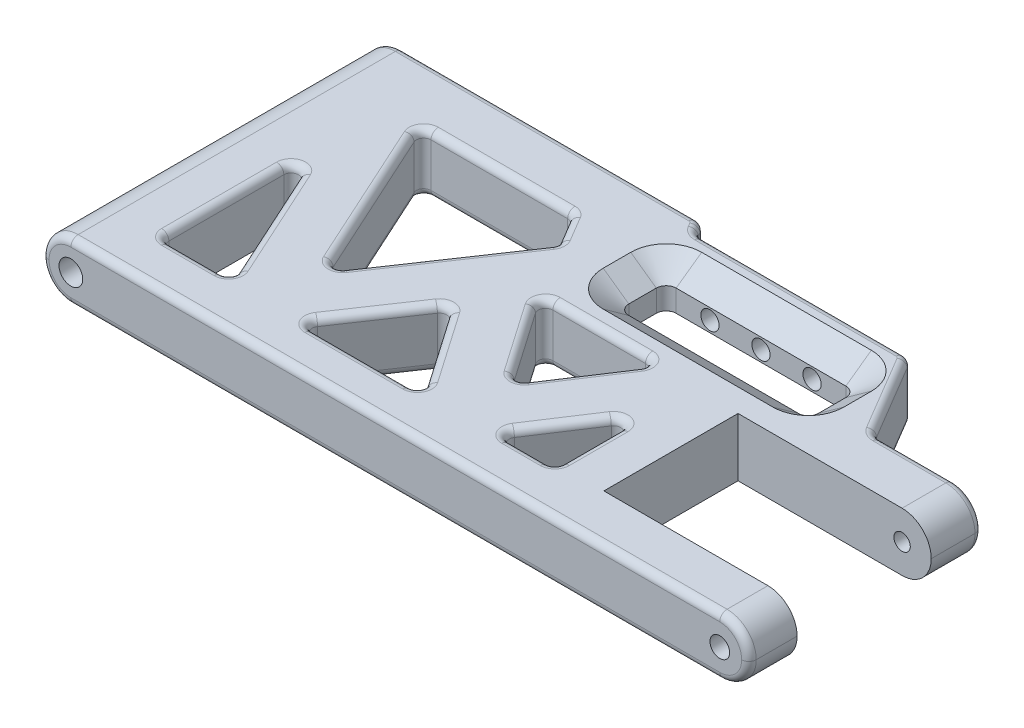
from build123d import *
from OCP.BRepFilletAPI import BRepFilletAPI_MakeChamfer

# Parameters (mm, degrees)
BOSS_EXTRU_1_DEPTH                            = 4
BOSS_EXTRU_1_DEPTH_BACK                       = 4
CONG_1_R                                      = 4
CONG_2_R                                      = 1
CHANFREIN2_SIZE                               = 3.5
CHANFREIN2_SIZE2                              = 2.5
CHANFREIN3_SIZE                               = 2.5
CHANFREIN3_SIZE2                              = 3.5
ENL_V_MAT_EXTRU_1_DEPTH                       = 100.712398932
ENL_V_MAT_EXTRU_1_DEPTH_BACK                  = 8.25
ESQUISSE6_R                                   = 1.125
ENL_V_MAT_EXTRU_2_DEPTH                       = 100.712398932
ENL_V_MAT_EXTRU_2_DEPTH_BACK                  = 100.712398932
ESQUISSE14_R                                  = 1.625
TROU_TARAUD_M31_D                             = 2.5
TROU_TARAUD_M31_DEPTH                         = 16
TROU_TARAUD_M31_TIP                           = 0.751075774
TROU_POUR_TARAUDAGE_POUR_TROU_TARAUD_M3_D     = 2.7
TROU_POUR_TARAUDAGE_POUR_TROU_TARAUD_M3_DEPTH = 3
TROU_POUR_TARAUDAGE_POUR_TROU_TARAUD_M3_TIP   = 0.811161836


with BuildPart() as part:
    # Esquisse1 → Boss.-Extru.1 (new, two sides: drawn at the far end of the back side and taken through both)
    with BuildSketch(Plane(origin=(0, 0, 0), x_dir=(1, 0, 0), z_dir=(0, 1, 0)).offset(-BOSS_EXTRU_1_DEPTH_BACK)):
        with BuildLine():
            Line((97, 2.25), (97, 9.25))
            Line((97, 9.25), (83, 9.25))
            ThreePointArc((83, 9.25), (82.325488354, 9.428591801), (81.827729995, 9.917567882))
            Line((81.827729995, 9.917567882), (75.708100575, 20.232432118))
            ThreePointArc((75.708100575, 20.232432118), (75.210342216, 20.721408199), (74.53583057, 20.9))
            Line((74.53583057, 20.9), (46.908568545, 20.9))
            ThreePointArc((46.908568545, 20.9), (46.234056899, 21.078591801), (45.73629854, 21.567567882))
            Line((45.73629854, 21.567567882), (45.43083855, 22.082432118))
            ThreePointArc((45.43083855, 22.082432118), (44.933080191, 22.571408199), (44.258568545, 22.75))
            Line((44.258568545, 22.75), (0, 22.75))
            Line((0, 22.75), (0, -22.75))
            Line((0, -22.75), (97, -22.75))
            Line((97, -22.75), (97, -16.15))
            Line((97, -16.15), (70.5, -16.15))
            Line((70.5, -16.15), (70.5, 2.25))
            Line((70.5, 2.25), (97, 2.25))
        make_face()
        with BuildLine():
            Line((64.118926942, -15.494213934), (64.118926942, -7.467196467))
            ThreePointArc((64.118926942, -7.467196467), (63.40501164, -6.508992133), (62.28261585, -6.918941272))
            Line((62.28261585, -6.918941272), (57.020394564, -14.945958739))
            ThreePointArc((57.020394564, -14.945958739), (56.976860443, -15.969474287), (57.856705655, -16.494213934))
            Line((57.856705655, -16.494213934), (63.118926942, -16.494213934))
            ThreePointArc((63.118926942, -16.494213934), (63.826033723, -16.201320715), (64.118926942, -15.494213934))
        make_face(mode=Mode.SUBTRACT)
        with BuildLine():
            Line((43.706678059, 1.262360149), (50.246967928, -8.178055844))
            ThreePointArc((50.246967928, -8.178055844), (51.081770931, -8.608492208), (51.905283012, -8.156829314))
            Line((51.905283012, -8.156829314), (58.077143514, 1.257756154))
            ThreePointArc((58.077143514, 1.257756154), (58.121403942, 2.298347662), (57.226879713, 2.831841874))
            Line((57.226879713, 2.831841874), (44.528682052, 2.831841874))
            ThreePointArc((44.528682052, 2.831841874), (43.642826046, 2.29580215), (43.706678059, 1.262360149))
        make_face(mode=Mode.SUBTRACT)
        with BuildLine():
            Line((31.174870916, -16.835427898), (44.603118761, -16.835427898))
            ThreePointArc((44.603118761, -16.835427898), (45.488974767, -16.299388174), (45.425122754, -15.265946173))
            Line((45.425122754, -15.265946173), (38.625355248, -5.450993747))
            ThreePointArc((38.625355248, -5.450993747), (37.797407047, -5.02049314), (36.974635235, -5.460806143))
            Line((36.974635235, -5.460806143), (30.346154896, -15.275758569))
            ThreePointArc((30.346154896, -15.275758569), (30.291788437, -16.304645689), (31.174870916, -16.835427898))
        make_face(mode=Mode.SUBTRACT)
        with BuildLine():
            Line((11, -16.307365767), (18.197304045, -16.307365767))
            ThreePointArc((18.197304045, -16.307365767), (19.038505434, -15.848087712), (19.107016148, -14.89212621))
            Line((19.107016148, -14.89212621), (11.909712103, 0.875819046))
            ThreePointArc((11.909712103, 0.875819046), (10.787528947, 1.437746851), (10, 0.460579489))
            Line((10, 0.460579489), (10, -15.307365767))
            ThreePointArc((10, -15.307365767), (10.292893219, -16.014472548), (11, -16.307365767))
        make_face(mode=Mode.SUBTRACT)
        with BuildLine():
            Line((15.042983852, 13.277394676), (24.357941957, -7.129934034))
            ThreePointArc((24.357941957, -7.129934034), (25.184858643, -7.711261043), (26.09637008, -7.274363807))
            Line((26.09637008, -7.274363807), (37.559429709, 9.69926803))
            ThreePointArc((37.559429709, 9.69926803), (37.73028563, 10.229680965), (37.590744848, 10.769178877))
            Line((37.590744848, 10.769178877), (35.553592257, 14.20287575))
            ThreePointArc((35.553592257, 14.20287575), (35.188413846, 14.561611079), (34.693561099, 14.692634233))
            Line((34.693561099, 14.692634233), (15.952695955, 14.692634233))
            ThreePointArc((15.952695955, 14.692634233), (15.111494566, 14.233356178), (15.042983852, 13.277394676))
        make_face(mode=Mode.SUBTRACT)
        with BuildLine():
            Line((48.863055272, 15.4), (72.136944728, 15.4))
            ThreePointArc((72.136944728, 15.4), (73.100770354, 15.000770354), (73.5, 14.036944728))
            Line((73.5, 14.036944728), (73.5, 10.263055272))
            ThreePointArc((73.5, 10.263055272), (73.100770354, 9.299229646), (72.136944728, 8.9))
            Line((72.136944728, 8.9), (48.863055272, 8.9))
            ThreePointArc((48.863055272, 8.9), (47.899229646, 9.299229646), (47.5, 10.263055272))
            Line((47.5, 10.263055272), (47.5, 14.036944728))
            ThreePointArc((47.5, 14.036944728), (47.899229646, 15.000770354), (48.863055272, 15.4))
        make_face(mode=Mode.SUBTRACT)
    extrude(amount=BOSS_EXTRU_1_DEPTH + BOSS_EXTRU_1_DEPTH_BACK)

    # Congé1
    cong_1_edges = [part.edges().sort_by_distance(p)[0] for p in [
        (0, 4, 0),
        (97, -4, -5.75),
        (97, -4, 19.45),
        (97, 4, 19.45),
        (97, 4, -5.75),
        (0, -4, 0),
    ]]
    fillet(cong_1_edges, radius=CONG_1_R - 0.0001)  # a hair under: the kernel refuses the full size

    # Congé2
    cong_2_edges = [part.edges().sort_by_distance(p)[0] for p in [
        (25.184858643, -4, 7.711261043),
        (19.700462905, -4, -3.073730321),
        (15.111494566, -4, -14.233356178),
        (25.323128527, -4, -14.692634233),
        (35.188413846, -4, -14.561611079),
        (36.572168553, -4, -12.486027314),
        (37.73028563, -4, -10.229680965),
        (31.827899895, -4, -1.212452112),
        (82.325488354, 4, -9.428591801),
        (78.767915285, 4, -15.075),
        (75.210342216, 4, -20.721408199),
        (60.722199558, 4, -20.9),
        (46.234056899, 4, -21.078591801),
        (45.583568545, 4, -21.825),
        (44.933080191, 4, -22.571408199),
        (24.129234273, 4, -22.75),
        (63.826033723, 4, 16.201320715),
        (64.118926942, 4, 11.480705201),
        (63.40501164, 4, 6.508992133),
        (59.651505207, 4, 10.932450006),
        (56.976860443, 4, 15.969474287),
        (60.487816298, 4, 16.494213934),
        (43.642826046, 4, -2.29580215),
        (46.976822993, 4, 3.457847847),
        (51.081770931, 4, 8.608492208),
        (54.991213263, 4, 3.44953658),
        (58.121403942, 4, -2.298347662),
        (50.877780882, 4, -2.831841874),
        (45.488974767, 4, 16.299388174),
        (42.025239001, 4, 10.35846996),
        (37.797407047, 4, 5.02049314),
        (33.660395066, 4, 10.368282356),
        (30.291788437, 4, 16.304645689),
        (37.888994839, 4, 16.835427898),
        (19.038505434, 4, 15.848087712),
        (15.508364125, 4, 7.008153582),
        (10.787528947, 4, -1.437746851),
        (10, 4, 7.423393139),
        (10.292893219, 4, 16.014472548),
        (14.598652022, 4, 16.307365767),
        (25.184858643, 4, 7.711261043),
        (31.827899895, 4, -1.212452112),
        (37.73028563, 4, -10.229680965),
        (36.572168553, 4, -12.486027314),
        (35.188413846, 4, -14.561611079),
        (25.323128527, 4, -14.692634233),
        (15.111494566, 4, -14.233356178),
        (19.700462905, 4, -3.073730321),
        (82.325488354, -4, -9.428591801),
        (88.00005, 4, -9.25),
        (88.00005, -4, -9.25),
        (95.828456414, 2.828456414, -9.25),
        (95.828456414, -2.828456414, -9.25),
        (48.5, -4, 22.75),
        (48.5, 4, 22.75),
        (1.171543586, 2.828456414, 22.75),
        (1.171543586, -2.828456414, 22.75),
        (95.828456414, 2.828456414, 22.75),
        (95.828456414, -2.828456414, 22.75),
        (1.171543586, 2.828456414, -22.75),
        (1.171543586, -2.828456414, -22.75),
        (78.767915285, -4, -15.075),
        (75.210342216, -4, -20.721408199),
        (60.722199558, -4, -20.9),
        (46.234056899, -4, -21.078591801),
        (63.826033723, -4, 16.201320715),
        (45.583568545, -4, -21.825),
        (60.487816298, -4, 16.494213934),
        (56.976860443, -4, 15.969474287),
        (59.651505207, -4, 10.932450006),
        (63.40501164, -4, 6.508992133),
        (64.118926942, -4, 11.480705201),
        (44.933080191, -4, -22.571408199),
        (24.129234273, -4, -22.75),
        (43.642826046, -4, -2.29580215),
        (50.877780882, -4, -2.831841874),
        (58.121403942, -4, -2.298347662),
        (54.991213263, -4, 3.44953658),
        (51.081770931, -4, 8.608492208),
        (46.976822993, -4, 3.457847847),
        (45.488974767, -4, 16.299388174),
        (37.888994839, -4, 16.835427898),
        (30.291788437, -4, 16.304645689),
        (33.660395066, -4, 10.368282356),
        (37.797407047, -4, 5.02049314),
        (42.025239001, -4, 10.35846996),
    ]]
    fillet(cong_2_edges, radius=CONG_2_R)

    # Chanfrein2
    chanfrein2_edges = [part.edges().sort_by_distance(p)[0] for p in [
        (47.899229646, 4, -15.000770354),
        (47.5, 4, -12.15),
        (47.899229646, 4, -9.299229646),
        (60.5, 4, -8.9),
        (73.100770354, 4, -9.299229646),
        (73.5, 4, -12.15),
        (73.100770354, 4, -15.000770354),
        (60.5, 4, -15.4),
    ]]
    chanfrein2_side = [part.faces().sort_by_distance(p)[0] for p in [
        (43.729526478, 4, 0.683000993),
    ]]
    chamfer(chanfrein2_edges, length=CHANFREIN2_SIZE, length2=CHANFREIN2_SIZE2, reference=chanfrein2_side[0])

    # Chanfrein3: one chamfer whose edges measure the first distance from different faces: ONE call of the kernel's chamfer builder (chamfer() names one face for all edges)
    chanfrein3_edges_1 = [part.edges().sort_by_distance(p)[0] for p in [
        (47.899229646, -4, -15.000770354),
    ]]
    chanfrein3_side_1 = [part.faces().sort_by_distance(p)[0] for p in [
        (47.899229646, -1.25, -15.000770354),
    ]]
    chanfrein3_edges_2 = [part.edges().sort_by_distance(p)[0] for p in [
        (60.5, -4, -15.4),
    ]]
    chanfrein3_side_2 = [part.faces().sort_by_distance(p)[0] for p in [
        (60.5, -1.25, -15.4),
    ]]
    chanfrein3_edges_3 = [part.edges().sort_by_distance(p)[0] for p in [
        (73.100770354, -4, -15.000770354),
    ]]
    chanfrein3_side_3 = [part.faces().sort_by_distance(p)[0] for p in [
        (73.100770354, -1.25, -15.000770354),
    ]]
    chanfrein3_edges_4 = [part.edges().sort_by_distance(p)[0] for p in [
        (73.5, -4, -12.15),
    ]]
    chanfrein3_side_4 = [part.faces().sort_by_distance(p)[0] for p in [
        (73.5, -1.25, -12.15),
    ]]
    chanfrein3_edges_5 = [part.edges().sort_by_distance(p)[0] for p in [
        (73.100770354, -4, -9.299229646),
    ]]
    chanfrein3_side_5 = [part.faces().sort_by_distance(p)[0] for p in [
        (73.100770354, -1.25, -9.299229646),
    ]]
    chanfrein3_edges_6 = [part.edges().sort_by_distance(p)[0] for p in [
        (60.5, -4, -8.9),
    ]]
    chanfrein3_side_6 = [part.faces().sort_by_distance(p)[0] for p in [
        (60.5, -1.25, -8.9),
    ]]
    chanfrein3_edges_7 = [part.edges().sort_by_distance(p)[0] for p in [
        (47.899229646, -4, -9.299229646),
    ]]
    chanfrein3_side_7 = [part.faces().sort_by_distance(p)[0] for p in [
        (47.899229646, -1.25, -9.299229646),
    ]]
    chanfrein3_edges_8 = [part.edges().sort_by_distance(p)[0] for p in [
        (47.5, -4, -12.15),
    ]]
    chanfrein3_side_8 = [part.faces().sort_by_distance(p)[0] for p in [
        (47.5, -1.25, -12.15),
    ]]
    chanfrein3 = BRepFilletAPI_MakeChamfer(part.part.solid().wrapped)
    for e in chanfrein3_edges_1:
        chanfrein3.Add(CHANFREIN3_SIZE, CHANFREIN3_SIZE2, e.wrapped, chanfrein3_side_1[0].wrapped)  # the first distance lies on this face
    for e in chanfrein3_edges_2:
        chanfrein3.Add(CHANFREIN3_SIZE, CHANFREIN3_SIZE2, e.wrapped, chanfrein3_side_2[0].wrapped)  # the first distance lies on this face
    for e in chanfrein3_edges_3:
        chanfrein3.Add(CHANFREIN3_SIZE, CHANFREIN3_SIZE2, e.wrapped, chanfrein3_side_3[0].wrapped)  # the first distance lies on this face
    for e in chanfrein3_edges_4:
        chanfrein3.Add(CHANFREIN3_SIZE, CHANFREIN3_SIZE2, e.wrapped, chanfrein3_side_4[0].wrapped)  # the first distance lies on this face
    for e in chanfrein3_edges_5:
        chanfrein3.Add(CHANFREIN3_SIZE, CHANFREIN3_SIZE2, e.wrapped, chanfrein3_side_5[0].wrapped)  # the first distance lies on this face
    for e in chanfrein3_edges_6:
        chanfrein3.Add(CHANFREIN3_SIZE, CHANFREIN3_SIZE2, e.wrapped, chanfrein3_side_6[0].wrapped)  # the first distance lies on this face
    for e in chanfrein3_edges_7:
        chanfrein3.Add(CHANFREIN3_SIZE, CHANFREIN3_SIZE2, e.wrapped, chanfrein3_side_7[0].wrapped)  # the first distance lies on this face
    for e in chanfrein3_edges_8:
        chanfrein3.Add(CHANFREIN3_SIZE, CHANFREIN3_SIZE2, e.wrapped, chanfrein3_side_8[0].wrapped)  # the first distance lies on this face
    add(Compound.cast(chanfrein3.Shape()), mode=Mode.REPLACE)

    # Esquisse6 → Enlèv. mat.-Extru.1 (cut, two sides: drawn at the far end of the back side and taken through both)
    with BuildSketch(Plane.XY.offset(-ENL_V_MAT_EXTRU_1_DEPTH_BACK)):
        with Locations((93, 0)):
            Circle(ESQUISSE6_R)
    extrude(amount=ENL_V_MAT_EXTRU_1_DEPTH + ENL_V_MAT_EXTRU_1_DEPTH_BACK, mode=Mode.SUBTRACT)

    # Esquisse14 → Enlèv. mat.-Extru.2 (cut, two sides: drawn at the far end of the back side and taken through both)
    with BuildSketch(Plane.XY.offset(-ENL_V_MAT_EXTRU_2_DEPTH_BACK)):
        with Locations((4, 0)):
            Circle(ESQUISSE14_R)
    extrude(amount=ENL_V_MAT_EXTRU_2_DEPTH + ENL_V_MAT_EXTRU_2_DEPTH_BACK, mode=Mode.SUBTRACT)

    # Trou taraudé M31
    with Locations(Plane(origin=(0, 0, -20.9), x_dir=(-1, 0, 0), z_dir=(0, 0, -1))):
        with Locations((-60.5, 0), (-53.5, 0), (-67.5, 0)):
            Hole(TROU_TARAUD_M31_D / 2, depth=TROU_TARAUD_M31_DEPTH)
            with Locations((0, 0, -(TROU_TARAUD_M31_DEPTH + TROU_TARAUD_M31_TIP / 2))):  # 118° drill point
                Cone(0, TROU_TARAUD_M31_D / 2, TROU_TARAUD_M31_TIP, mode=Mode.SUBTRACT)

    # Trou pour taraudage pour trou taraudé M31
    with Locations(Plane.XY.offset(22.75)):
        with Locations((93, 0)):
            Hole(TROU_POUR_TARAUDAGE_POUR_TROU_TARAUD_M3_D / 2, depth=TROU_POUR_TARAUDAGE_POUR_TROU_TARAUD_M3_DEPTH)
            with Locations((0, 0, -(TROU_POUR_TARAUDAGE_POUR_TROU_TARAUD_M3_DEPTH + TROU_POUR_TARAUDAGE_POUR_TROU_TARAUD_M3_TIP / 2))):  # 118° drill point
                Cone(0, TROU_POUR_TARAUDAGE_POUR_TROU_TARAUD_M3_D / 2, TROU_POUR_TARAUDAGE_POUR_TROU_TARAUD_M3_TIP, mode=Mode.SUBTRACT)


solid = part.part
